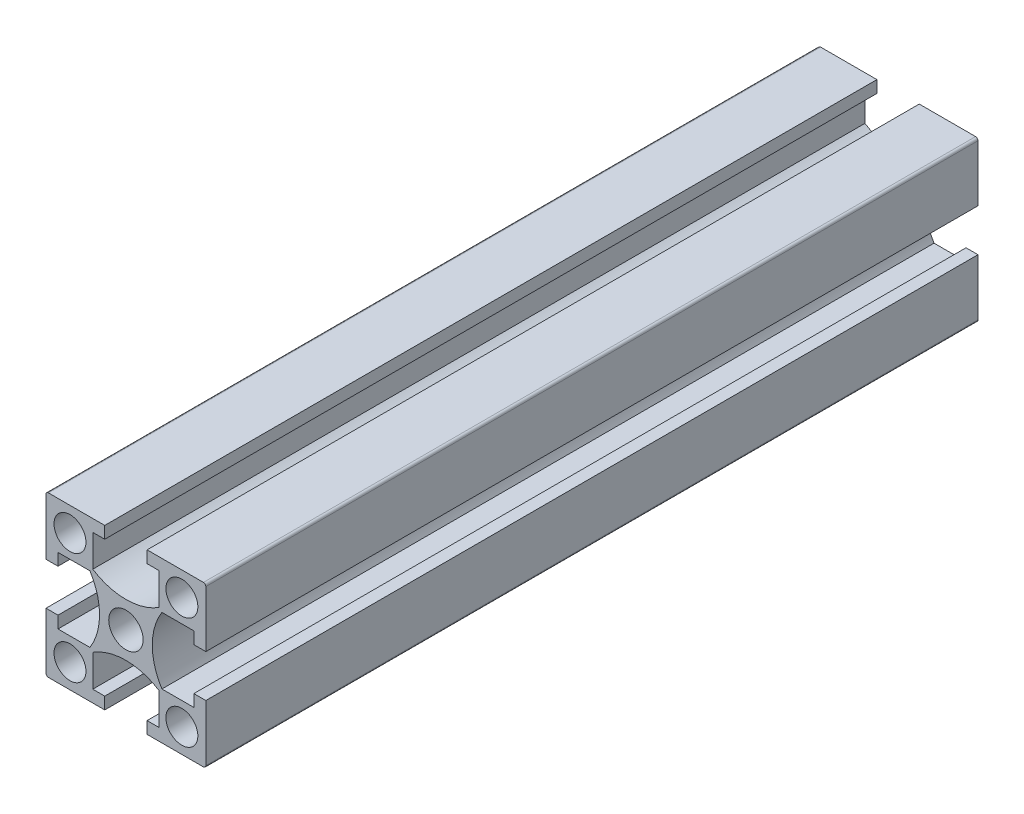
from build123d import *

# Parameters (mm, degrees)
SKETCH_1_W               = 20
SKETCH_1_H               = 20
SKETCH_1_R               = 2
SKETCH_1_R_2             = 2.15
EXTRUDE_1_DEPTH          = 293
CUT_EXTRUDE_1_REACH      = 295.341
PATTERN_CIRCULAR_1_COUNT = 4
FILLET_1_R               = 0.3
CUT_EXTRUDE_2_DEPTH      = 294.341098382
CUT_EXTRUDE_2_DEPTH_BACK = 294.341098382
SKETCH_2_R               = 2.5
SKETCH_4_R               = 2.5
CUT_EXTRUDE_3_DEPTH      = 294.852003666
SKETCH_6_R               = 2.15
SKETCH_6_R_2             = 1.97965
CUT_EXTRUDE_4_DEPTH      = 294.852003666
SKETCH_7_W               = 20
SKETCH_7_H               = 196.38
CUT_EXTRUDE_5_DEPTH      = 294.852003666


with BuildPart() as part:
    # 스케치1 → 보스-돌출1 (new body)
    with BuildSketch(Plane.XY):
        Rectangle(SKETCH_1_W, SKETCH_1_H)
        with Locations((-7, -7)):
            Circle(SKETCH_1_R, mode=Mode.SUBTRACT)
        with Locations((7, -7)):
            Circle(SKETCH_1_R, mode=Mode.SUBTRACT)
        with Locations((-7, 7)):
            Circle(SKETCH_1_R, mode=Mode.SUBTRACT)
        Circle(SKETCH_1_R_2, mode=Mode.SUBTRACT)
        with Locations((7, 7)):
            Circle(SKETCH_1_R, mode=Mode.SUBTRACT)
    extrude(amount=EXTRUDE_1_DEPTH)

    # 스케치1<3> → 컷-돌출1 (cut, up to next)
    with BuildSketch(Plane.XY, mode=Mode.PRIVATE) as cut_extrude_1_sk1:
        with BuildLine():
            Line((-8.5, 2.65), (-10, 2.65))
            Line((-10, 2.65), (-10, -2.65))
            Line((-10, -2.65), (-8.5, -2.65))
            Line((-8.5, -2.65), (-8.5, -4.15))
            Line((-8.5, -4.15), (-4.503166667, -4.15))
            ThreePointArc((-4.503166667, -4.15), (-3.3, 0), (-4.503166667, 4.15))
            Line((-4.503166667, 4.15), (-8.5, 4.15))
            Line((-8.5, 4.15), (-8.5, 2.65))
        make_face()
    cut_extrude_1_tool1 = extrude(cut_extrude_1_sk1.sketch, amount=CUT_EXTRUDE_1_REACH, mode=Mode.PRIVATE) & part.part
    cut_extrude_1 = cut_extrude_1_tool1.solids().sort_by_distance((-6.606913, 0, 0))[0]
    add(cut_extrude_1, mode=Mode.SUBTRACT)

    # 원형 패턴1: 컷-돌출1 ×4 about axis
    pattern_circular_1_axis = Axis((0, 0, 293), (0, 0, -1))
    for i in range(1, PATTERN_CIRCULAR_1_COUNT):
        add(cut_extrude_1.rotate(pattern_circular_1_axis, i * 360 / PATTERN_CIRCULAR_1_COUNT), mode=Mode.SUBTRACT)

    # 필렛1
    fillet_1_edges = [part.edges().sort_by_distance(p)[0] for p in [
        (10, -10, 146.5),
        (-10, -10, 146.5),
        (-10, 10, 146.5),
        (10, 10, 146.5),
    ]]
    fillet(fillet_1_edges, radius=FILLET_1_R)

    # 스케치2 → 컷-돌출2 (cut, two sides: drawn at the far end of the back side and taken through both)
    with BuildSketch(Plane(origin=(0, 0, 0), x_dir=(0, 0, -1), z_dir=(1, 0, 0)).offset(-CUT_EXTRUDE_2_DEPTH_BACK)):
        with Locations((-25, 0)):
            Circle(SKETCH_2_R)
    extrude(amount=CUT_EXTRUDE_2_DEPTH + CUT_EXTRUDE_2_DEPTH_BACK, mode=Mode.SUBTRACT)

    # 스케치4 → 컷-돌출3 (cut, through all)
    with BuildSketch(Plane(origin=(0, 10, 0), x_dir=(1, 0, 0), z_dir=(0, 1, 0))):
        with Locations((0, -282)):
            Circle(SKETCH_4_R)
        with Locations((0, -127.62)):
            Circle(SKETCH_4_R)
    extrude(amount=-CUT_EXTRUDE_3_DEPTH, mode=Mode.SUBTRACT)

    # 스케치6 → 컷-돌출4 (cut, through all)
    with BuildSketch(Plane(origin=(0, 10, 0), x_dir=(1, 0, 0), z_dir=(0, 1, 0))):
        with Locations((0, -236.9)):
            Circle(SKETCH_6_R)
        with Locations((0, -184.9)):
            Circle(SKETCH_6_R)
        with Locations((0, -10.15)):
            Circle(SKETCH_6_R_2)
        with Locations((0, -62.15)):
            Circle(SKETCH_6_R)
    extrude(amount=-CUT_EXTRUDE_4_DEPTH, mode=Mode.SUBTRACT)

    # 스케치7 → 컷-돌출5 (cut, through all)
    with BuildSketch(Plane(origin=(0, 10, 0), x_dir=(1, 0, 0), z_dir=(0, 1, 0))):
        with Locations((0, -194.81)):
            Rectangle(SKETCH_7_W, SKETCH_7_H)
    extrude(amount=-CUT_EXTRUDE_5_DEPTH, mode=Mode.SUBTRACT)


solid = part.part
